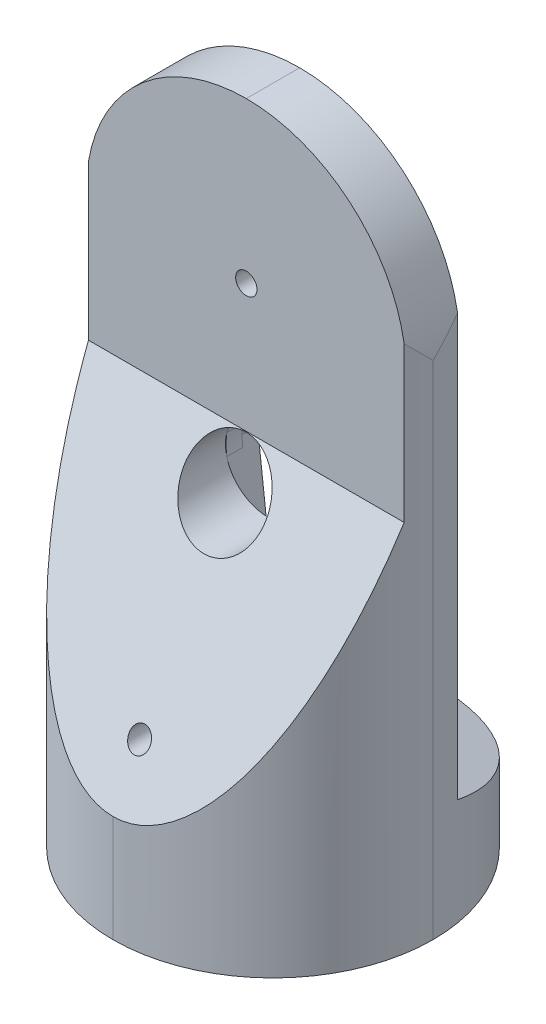
from build123d import *

# Parameters (mm, degrees)
SKETCH2_W            = 30
SKETCH2_H            = 62
BOSS_EXTRUDE10_DEPTH = 5
SKETCH1_R            = 1
CUT_EXTRUDE5_DEPTH   = 1.5
SKETCH1_14_R         = 1
CUT_EXTRUDE6_DEPTH   = 35.799425283
FILLET1_R            = 15
SKETCH5_W            = 30
SKETCH5_H            = 5
BOSS_EXTRUDE11_DEPTH = 12.5
FILLET2_R            = 15
SKETCH7_R            = 2.5
CUT_EXTRUDE7_DEPTH   = 3
CHAMFER1_SIZE        = 30
CHAMFER1_SIZE_2      = 15
CHAMFER2_SIZE        = 5
CHAMFER2_SIZE_2      = 15
CUT_EXTRUDE8_DEPTH   = 1.5
SKETCH9_R            = 3.95
CUT_EXTRUDE9_DEPTH   = 10


# Some blends are built 0.0001 mm under size
with BuildPart() as part:
    # Sketch2 → Boss-Extrude10 (new body)
    with BuildSketch(Plane.XY):
        Rectangle(SKETCH2_W, SKETCH2_H)
    extrude(amount=BOSS_EXTRUDE10_DEPTH)

    # Sketch1 → Cut-Extrude5 (cut)
    with BuildSketch(Plane.XY):
        with BuildLine():
            ThreePointArc((2.1, -16), (0, -18.1), (-2.1, -16))
            Line((-2.1, -16), (-3.95, 0))
            Line((-3.95, 0), (-2.1, 16))
            ThreePointArc((-2.1, 16), (0, 18.1), (2.1, 16))
            Line((2.1, 16), (3.95, 0))
            Line((3.95, 0), (2.1, -16))
        make_face()
        with Locations((0, -16)):
            Circle(SKETCH1_R, mode=Mode.SUBTRACT)
        with Locations((0, 16)):
            Circle(SKETCH1_R, mode=Mode.SUBTRACT)
    extrude(amount=CUT_EXTRUDE5_DEPTH, mode=Mode.SUBTRACT)

    # Sketch1<14> → Cut-Extrude6 (cut, through all)
    with BuildSketch(Plane.XY):
        with Locations((0, 16)):
            Circle(SKETCH1_14_R)
        with Locations((0, -16)):
            Circle(SKETCH1_14_R)
    extrude(amount=CUT_EXTRUDE6_DEPTH, mode=Mode.SUBTRACT)

    # Fillet1
    fillet1_edges = [part.edges().sort_by_distance(p)[0] for p in [
        (-15, 31, 2.5),
        (15, 31, 2.5),
    ]]
    fillet(fillet1_edges, radius=FILLET1_R - 0.0001)  # a hair under: the kernel refuses the full size

    # Sketch5 → Boss-Extrude11 (add)
    with BuildSketch(Plane(origin=(0, 0, 0), x_dir=(-1, 0, 0), z_dir=(0, 0, -1))):
        with Locations((0, -28.5)):
            Rectangle(SKETCH5_W, SKETCH5_H)
    boss_extrude11 = extrude(amount=BOSS_EXTRUDE11_DEPTH)

    # Mirror1: Boss-Extrude11 across plane
    add(boss_extrude11.mirror(Plane.XY.offset(2.5)))

    # Fillet2
    # the kernel refuses this fillet: 15 mm, written as the material it takes off along each edge
    with BuildSketch(Plane(origin=(15, 64, 17.5), x_dir=(0, 0, -1), z_dir=(0, -1, 0)), Plane(origin=(-15, -121, 17.5), x_dir=(0, 0, -1), z_dir=(0, 1, 0))) as fillet2_piece_1:
        with BuildLine():
            CenterArc((FILLET2_R, -FILLET2_R), FILLET2_R, 90, 90)
            Line((0, -FILLET2_R), (-FILLET2_R * 0.02, -FILLET2_R))
            Line((-FILLET2_R * 0.02, -FILLET2_R), (-FILLET2_R * 0.02, FILLET2_R * 0.02))
            Line((-FILLET2_R * 0.02, FILLET2_R * 0.02), (FILLET2_R, FILLET2_R * 0.02))
            Line((FILLET2_R, FILLET2_R * 0.02), (FILLET2_R, 0))
        make_face()
    extrude(amount=185, mode=Mode.SUBTRACT)
    with BuildSketch(Plane(origin=(-15, -121, -12.5), x_dir=(0, 0, 1), z_dir=(0, 1, 0)), Plane(origin=(15, 64, -12.5), x_dir=(0, 0, 1), z_dir=(0, -1, 0))) as fillet2_piece_2:
        with BuildLine():
            CenterArc((FILLET2_R, FILLET2_R), FILLET2_R, 180, 90)
            Line((0, FILLET2_R), (-FILLET2_R * 0.02, FILLET2_R))
            Line((-FILLET2_R * 0.02, FILLET2_R), (-FILLET2_R * 0.02, -FILLET2_R * 0.02))
            Line((-FILLET2_R * 0.02, -FILLET2_R * 0.02), (FILLET2_R, -FILLET2_R * 0.02))
            Line((FILLET2_R, -FILLET2_R * 0.02), (FILLET2_R, 0))
        make_face()
    extrude(amount=185, mode=Mode.SUBTRACT)

    # Sketch7 → Cut-Extrude7 (cut)
    with BuildSketch(Plane.XZ.offset(31)):
        with Locations(Location((0, 2.5, 0), (0, 0, 270))):
            Circle(SKETCH7_R)
    extrude(amount=-CUT_EXTRUDE7_DEPTH, mode=Mode.SUBTRACT)

    # Chamfer1
    # the kernel refuses this chamfer: 30, 15 mm, written as the material it adds along each edge
    with BuildSketch(Plane(origin=(-92.485065671, -26, 5), x_dir=(0, 0.9998508956747117, -0.017268075123668125), z_dir=(1, 0, 0))) as chamfer1_piece_1_section:
        Polygon((CHAMFER1_SIZE * 0.999850895675, CHAMFER1_SIZE * 0.0172680751237), (-CHAMFER1_SIZE_2 * 0.0172680751237, CHAMFER1_SIZE_2 * 0.999850895675), (0, 0), align=None)
    chamfer1_piece_1 = extrude(amount=184.970131343, mode=Mode.PRIVATE)
    chamfer1_piece_1 = chamfer1_piece_1 & Plane(origin=(0, -14.759423462, 2.5), x_dir=(0, 0, -1), z_dir=(0, -1, 0)) * Cylinder(15, 490, mode=Mode.PRIVATE)
    chamfer1_piece_1 = chamfer1_piece_1 - Plane(origin=(0, -16, 8.704221218), x_dir=(1, 0, 0), z_dir=(0, 0, -1)) * Cylinder(1, 490, mode=Mode.PRIVATE)
    add(chamfer1_piece_1)

    # Chamfer2
    # the kernel refuses this chamfer: 15, 5 mm, written as the material it adds along each edge
    with BuildSketch(Plane(origin=(-53.716114618, -26, 0), x_dir=(0, 0.9940388851139267, 0.10902612017980706), z_dir=(1, 0, 0))) as chamfer2_piece_1_section:
        Polygon((CHAMFER2_SIZE * 0.994038885114, -CHAMFER2_SIZE * 0.10902612018), (-CHAMFER2_SIZE_2 * 0.10902612018, -CHAMFER2_SIZE_2 * 0.994038885114), (0, 0), align=None)
    chamfer2_piece_1 = extrude(amount=107.432229235, mode=Mode.PRIVATE)
    chamfer2_piece_1 = chamfer2_piece_1 & Plane(origin=(0, -24.267585927, 2.5), x_dir=(0, 0, -1), z_dir=(0, -1, 0)) * Cylinder(15, 275, mode=Mode.PRIVATE)
    add(chamfer2_piece_1)

    # Sketch8 → Cut-Extrude8 (cut)
    with BuildSketch(Plane(origin=(0, 0, 1.5), x_dir=(-1, 0, 0), z_dir=(0, 0, -1))):
        with BuildLine():
            Line((-3.3140625, -5.5), (3.3140625, -5.5))
            Line((3.3140625, -5.5), (3.837114391, -0.976307969))
            ThreePointArc((3.837114391, -0.976307969), (3.893369798, 0), (3.837114391, 0.976307969))
            Line((3.837114391, 0.976307969), (3.3140625, 5.5))
            Line((3.3140625, 5.5), (-3.3140625, 5.5))
            Line((-3.3140625, 5.5), (-3.837114391, 0.976307969))
            ThreePointArc((-3.837114391, 0.976307969), (-3.893369798, 0), (-3.837114391, -0.976307969))
            Line((-3.837114391, -0.976307969), (-3.3140625, -5.5))
        make_face()
    extrude(amount=-CUT_EXTRUDE8_DEPTH, mode=Mode.SUBTRACT)

    # Sketch9 → Cut-Extrude9 (cut)
    with BuildSketch(Plane(origin=(0, 0, 3), x_dir=(-1, 0, 0), z_dir=(0, 0, -1))):
        with Locations(Location((0, 0, 0), (0, 0, 13.230259738))):
            Circle(SKETCH9_R)
    extrude(amount=-CUT_EXTRUDE9_DEPTH, mode=Mode.SUBTRACT)


solid = part.part
